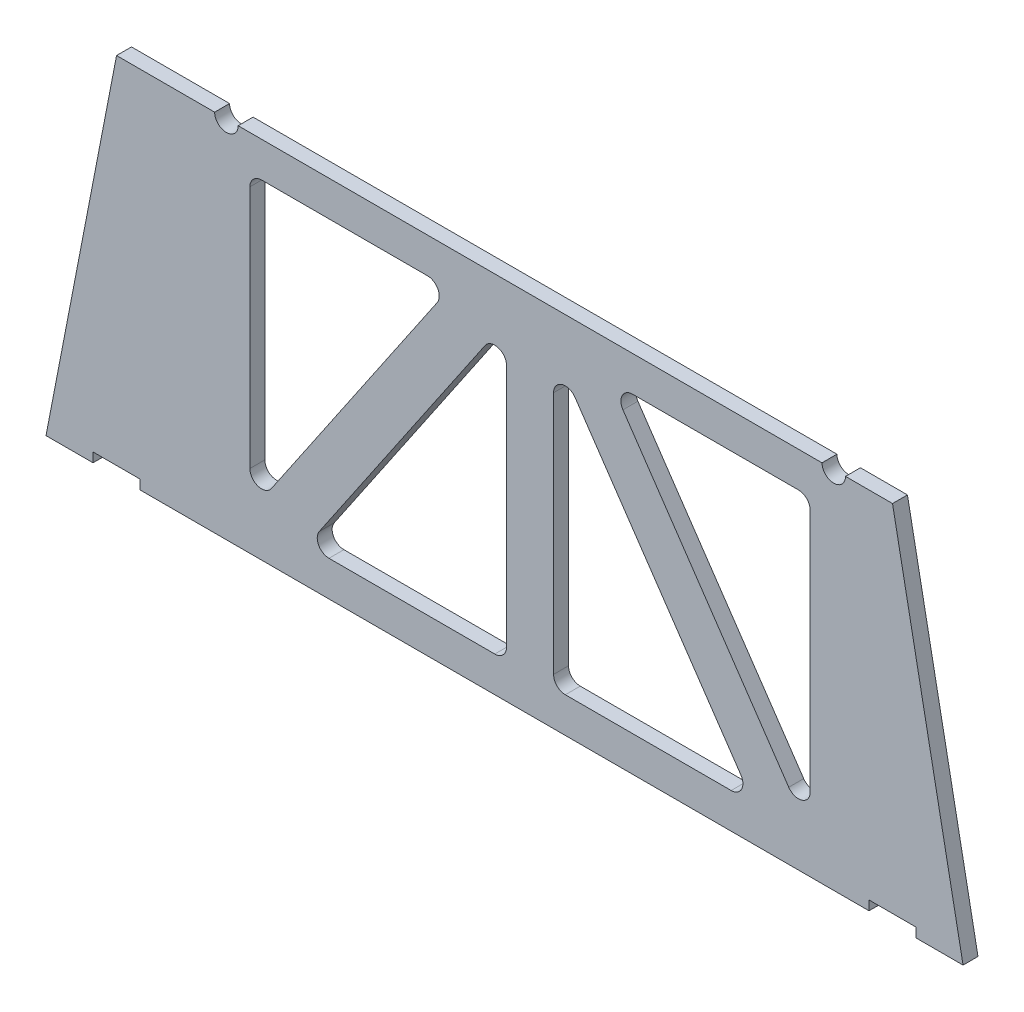
from build123d import *

# Parameters (mm, degrees)
EXTRUDE1_DEPTH = 6.35


with BuildPart() as part:
    # Sketch1 → Extrude1 (new body)
    with BuildSketch(Plane.XY):
        with BuildLine():
            Line((-165.85625, -73.5), (-165.85625, -77.5))
            Line((-165.85625, -77.5), (144.14375, -77.5))
            Line((144.14375, -77.5), (144.14375, -73.5))
            Line((144.14375, -73.5), (164.14375, -73.5))
            Line((164.14375, -73.5), (164.14375, -77.5))
            Line((164.14375, -77.5), (184.14375, -77.5))
            Line((184.14375, -77.5), (154.14375, 77.5))
            Line((154.14375, 77.5), (134.14375, 77.5))
            ThreePointArc((134.14375, 77.5), (129.14375, 72.5), (124.14375, 77.5))
            Line((124.14375, 77.5), (-124.14375, 77.5))
            ThreePointArc((-124.14375, 77.5), (-129.14375, 72.5), (-134.14375, 77.5))
            Line((-134.14375, 77.5), (-175.85625, 77.5))
            Line((-175.85625, 77.5), (-205.85625, -77.5))
            Line((-205.85625, -77.5), (-185.85625, -77.5))
            Line((-185.85625, -77.5), (-185.85625, -73.5))
            Line((-185.85625, -73.5), (-165.85625, -73.5))
        make_face()
        with BuildLine():
            ThreePointArc((-85.517218791, -62.5), (-89.936119751, -59.839511554), (-89.652446731, -54.689325724))
            Line((-89.652446731, -54.689325724), (-19.13522794, 49.059719801))
            ThreePointArc((-19.13522794, 49.059719801), (-13.529649651, 51.027964843), (-10, 46.249045525))
            Line((-10, 46.249045525), (-10, -57.5))
            ThreePointArc((-10, -57.5), (-11.464466094, -61.035533906), (-15, -62.5))
            Line((-15, -62.5), (-85.517218791, -62.5))
        make_face(mode=Mode.SUBTRACT)
        with BuildLine():
            Line((-119.14375, -46.249045525), (-119.14375, 57.5))
            ThreePointArc((-119.14375, 57.5), (-117.679283906, 61.035533906), (-114.14375, 62.5))
            Line((-114.14375, 62.5), (-43.626531209, 62.5))
            ThreePointArc((-43.626531209, 62.5), (-39.207630249, 59.839511554), (-39.491303269, 54.689325724))
            Line((-39.491303269, 54.689325724), (-110.00852206, -49.059719801))
            ThreePointArc((-110.00852206, -49.059719801), (-115.614100349, -51.027964843), (-119.14375, -46.249045525))
        make_face(mode=Mode.SUBTRACT)
        with BuildLine():
            Line((43.626531209, 62.5), (114.14375, 62.5))
            ThreePointArc((114.14375, 62.5), (117.679283906, 61.035533906), (119.14375, 57.5))
            Line((119.14375, 57.5), (119.14375, -46.249045525))
            ThreePointArc((119.14375, -46.249045525), (115.614100349, -51.027964843), (110.00852206, -49.059719801))
            Line((110.00852206, -49.059719801), (39.491303269, 54.689325724))
            ThreePointArc((39.491303269, 54.689325724), (39.207630249, 59.839511554), (43.626531209, 62.5))
        make_face(mode=Mode.SUBTRACT)
        with BuildLine():
            Line((85.517218791, -62.5), (15, -62.5))
            ThreePointArc((15, -62.5), (11.464466094, -61.035533906), (10, -57.5))
            Line((10, -57.5), (10, 46.249045525))
            ThreePointArc((10, 46.249045525), (13.529649651, 51.027964843), (19.13522794, 49.059719801))
            Line((19.13522794, 49.059719801), (89.652446731, -54.689325724))
            ThreePointArc((89.652446731, -54.689325724), (89.936119751, -59.839511554), (85.517218791, -62.5))
        make_face(mode=Mode.SUBTRACT)
    extrude(amount=EXTRUDE1_DEPTH)


solid = part.part
